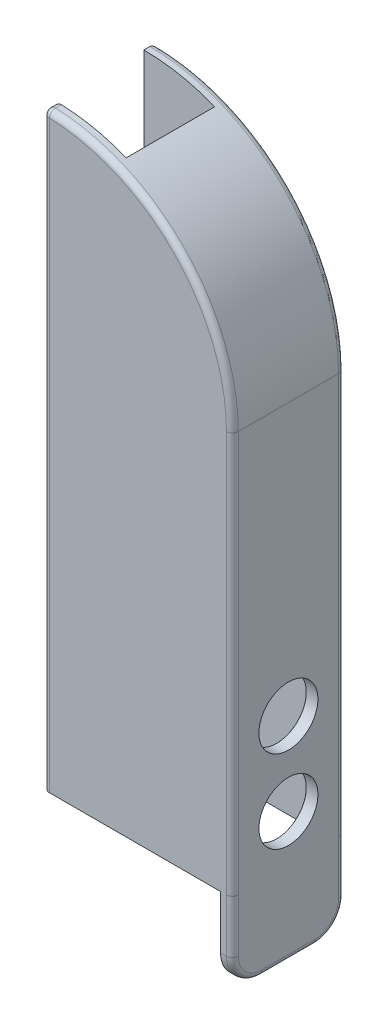
from build123d import *

# Parameters (mm, degrees)
BOSS_EXTRUDE1_DEPTH = 19
SKETCH2_W           = 24
SKETCH2_H           = 15
CUT_EXTRUDE1_DEPTH  = 29
SKETCH2_2_W         = 24
SKETCH2_2_H         = 15
CUT_EXTRUDE2_DEPTH  = 109
SHELL2_START        = 2
SHELL2_DEPTH        = 15
FILLET1_R           = 1
SKETCH8_W           = 2
SKETCH8_H           = 19
BOSS_EXTRUDE2_DEPTH = 14
FILLET3_R           = 5
FILLET4_R           = 1


# Read off the part's stored shape, not the designer's step: Shell2, M6 Tapped Hole1, Ø10.0mm Dowel Hole1
with BuildPart() as part:
    # Sketch1 → Boss-Extrude1 (new body)
    with BuildSketch(Plane.XY):
        with BuildLine():
            Line((32, 0), (32, 68))
            ThreePointArc((32, 68), (22.627416998, 90.627416998), (0, 100))
            Line((0, 100), (0, 0))
            Line((0, 0), (32, 0))
        make_face()
    extrude(amount=BOSS_EXTRUDE1_DEPTH)

    # Sketch2 → Cut-Extrude1 (cut)
    with BuildSketch(Plane(origin=(0, 0, 0), x_dir=(1, 0, 0), z_dir=(0, 1, 0))):
        with Locations((0, -9.5)):
            Rectangle(SKETCH2_W, SKETCH2_H)
    extrude(amount=CUT_EXTRUDE1_DEPTH, mode=Mode.SUBTRACT)

    # Sketch2<2> → Cut-Extrude2 (cut)
    with BuildSketch(Plane(origin=(0, 0, 0), x_dir=(1, 0, 0), z_dir=(0, 1, 0))):
        with Locations((0, -9.5)):
            Rectangle(SKETCH2_2_W, SKETCH2_2_H)
    extrude(amount=CUT_EXTRUDE2_DEPTH, mode=Mode.SUBTRACT)

    # Shell2 outline → Shell2 (cut)
    with BuildSketch(Plane.XY.offset(SHELL2_START)):
        with BuildLine():
            ThreePointArc((30, 68), (25.690465157, 83.491933385), (14, 94.532998323))
            Line((14, 94.532998323), (14, 0))
            Line((14, 0), (30, 0))
            Line((30, 0), (30, 68))
        make_face()
    extrude(amount=SHELL2_DEPTH, mode=Mode.SUBTRACT)

    # M6 Tapped Hole1 outline → M6 Tapped Hole1 (revolve, cut)
    with BuildSketch(Plane(origin=(0, 85, 9.5), x_dir=(0, 1, 0), z_dir=(0, 0, -1))):
        Polygon((2.5, 12.525), (2.5, 14), (0, 14), (0, 12), (3.025, 12), align=None)
    revolve(axis=Axis((0, 85, 9.5), (1, 0, 0)), mode=Mode.SUBTRACT)

    # M6 Tapped Hole1 2 outline → M6 Tapped Hole1 2 (revolve, cut)
    with BuildSketch(Plane(origin=(0, 65, 9.5), x_dir=(0, 1, 0), z_dir=(0, 0, -1))):
        Polygon((2.5, 12.525), (2.5, 14), (0, 14), (0, 12), (3.025, 12), align=None)
    revolve(axis=Axis((0, 65, 9.5), (1, 0, 0)), mode=Mode.SUBTRACT)

    # M6 Tapped Hole1 3 outline → M6 Tapped Hole1 3 (revolve, cut)
    with BuildSketch(Plane(origin=(0, 8, 9.5), x_dir=(0, 1, 0), z_dir=(0, 0, -1))):
        Polygon((2.5, 12.525), (2.5, 14), (0, 14), (0, 12), (3.025, 12), align=None)
    revolve(axis=Axis((0, 8, 9.5), (1, 0, 0)), mode=Mode.SUBTRACT)

    # M6 Tapped Hole1 4 outline → M6 Tapped Hole1 4 (revolve, cut)
    with BuildSketch(Plane(origin=(0, 22, 9.5), x_dir=(0, 1, 0), z_dir=(0, 0, -1))):
        Polygon((2.5, 12.525), (2.5, 14), (0, 14), (0, 12), (3.025, 12), align=None)
    revolve(axis=Axis((0, 22, 9.5), (1, 0, 0)), mode=Mode.SUBTRACT)

    # Ø10.0mm Dowel Hole1 outline → Ø10.0mm Dowel Hole1 (revolve, cut)
    with BuildSketch(Plane(origin=(0, 8, 9.5), x_dir=(0, 1, 0), z_dir=(0, 0, -1))):
        Polygon((5, 30.025), (5, 32), (0, 32), (0, 30), (5.025, 30), align=None)
    revolve(axis=Axis((0, 8, 9.5), (1, 0, 0)), mode=Mode.SUBTRACT)

    # 10.0mm Dowel Hole1 2 outline → 10.0mm Dowel Hole1 2 (revolve, cut)
    with BuildSketch(Plane(origin=(0, 22, 9.5), x_dir=(0, 1, 0), z_dir=(0, 0, -1))):
        Polygon((5, 30.025), (5, 32), (0, 32), (0, 30), (5.025, 30), align=None)
    revolve(axis=Axis((0, 22, 9.5), (1, 0, 0)), mode=Mode.SUBTRACT)

    # Fillet1
    fillet1_edges = [part.edges().sort_by_distance(p)[0] for p in [
        (22.627416998, 90.627416998, 19),
        (0, 50, 19),
        (0, 50, 0),
        (22.627416998, 90.627416998, 0),
        (32, 34, 0),
        (0, 100, 18),
        (32, 34, 19),
    ]]
    fillet(fillet1_edges, radius=FILLET1_R)

    # Sketch8 → Boss-Extrude2 (add)
    with BuildSketch(Plane(origin=(0, 0, 0), x_dir=(1, 0, 0), z_dir=(0, 1, 0))):
        with Locations((31, -9.5)):
            Rectangle(SKETCH8_W, SKETCH8_H)
    extrude(amount=-BOSS_EXTRUDE2_DEPTH)

    # Fillet3
    fillet3_edges = [part.edges().sort_by_distance(p)[0] for p in [
        (31, -14, 19),
        (31, -14, 0),
    ]]
    fillet(fillet3_edges, radius=FILLET3_R)

    # Fillet4
    fillet4_edges = [part.edges().sort_by_distance(p)[0] for p in [
        (32, -12.535533906, 1.464466094),
        (32, -14, 9.5),
        (32, -12.535533906, 17.535533906),
        (32, -4.5, 0),
        (32, -4.5, 19),
    ]]
    fillet(fillet4_edges, radius=FILLET4_R)


solid = part.part
